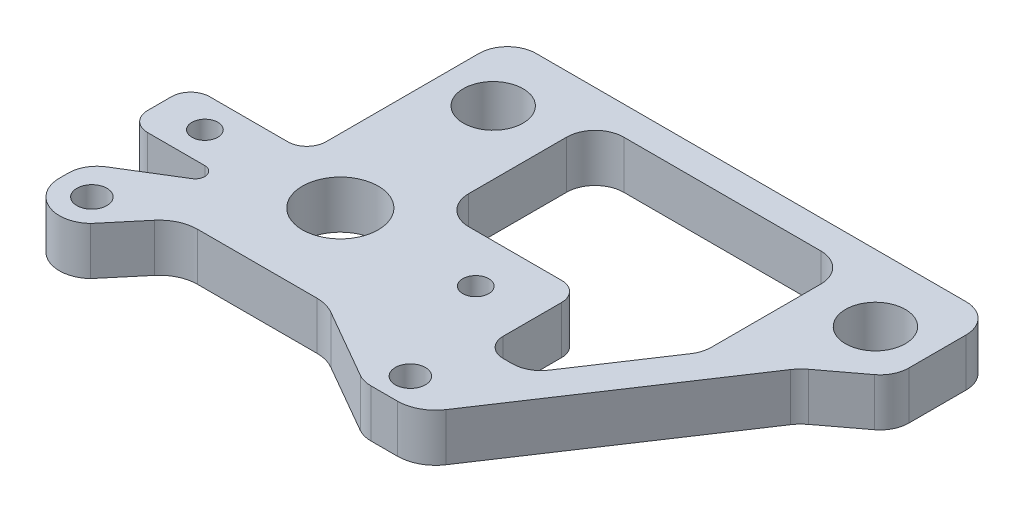
from build123d import *

# Parameters (mm, degrees)
SKETCH4_R           = 2
SKETCH4_R_2         = 1.7272
SKETCH4_R_3         = 5.04
SKETCH4_R_4         = 3.96875
BOSS_EXTRUDE2_DEPTH = 6.35
FILLET1_R           = 5.08
FILLET7_R           = 3.81
FILLET9_R           = 5.08
FILLET10_R          = 1.27
FILLET11_R          = 3.81
FILLET12_R          = 2.54
FILLET13_R          = 3.81


with BuildPart() as part:
    # Sketch4 → Boss-Extrude2 (new body)
    with BuildSketch(Plane(origin=(0, 0, 0), x_dir=(1, 0, 0), z_dir=(0, 1, 0))):
        with BuildLine():
            Line((22.483900583, -18.4375), (28.735494078, -18.4375))
            Line((28.735494078, -18.4375), (48.985566477, 12.027918285))
            Line((48.985566477, 12.027918285), (54.680415238, 16.319294633))
            ThreePointArc((54.680415238, 16.319294633), (55.797199918, 17.662082259), (56.1975, 19.362095927))
            Line((56.1975, 19.362095927), (56.1975, 26.9875))
            ThreePointArc((56.1975, 26.9875), (55.081576836, 29.681576836), (52.3875, 30.7975))
            Line((52.3875, 30.7975), (-4.7625, 30.7975))
            ThreePointArc((-4.7625, 30.7975), (-7.456576836, 29.681576836), (-8.5725, 26.9875))
            Line((-8.5725, 26.9875), (-8.5725, 12.607500122))
            Line((-8.5725, 12.607500122), (-8.5725, 4.1275))
            Line((-8.5725, 4.1275), (-24.03032317, 4.1275))
            Line((-24.03032317, 4.1275), (-24.03032317, -4.1275))
            Line((-24.03032317, -4.1275), (-9.399713355, -4.1275))
            Line((-9.399713355, -4.1275), (-22.098, -11.933490986))
            Line((-22.098, -11.933490986), (-22.098, -15.24))
            ThreePointArc((-22.098, -15.24), (-19.494143335, -19.203185162), (-14.822948297, -18.386580561))
            Line((-14.822948297, -18.386580561), (-9.399713355, -11.933490986))
            Line((-9.399713355, -11.933490986), (10.16293305, -11.933490986))
            Line((10.16293305, -11.933490986), (20.583679925, -17.929811531))
            ThreePointArc((20.583679925, -17.929811531), (21.500464498, -18.308390309), (22.483900583, -18.4375))
        make_face()
        with Locations((-17.78, -15.24)):
            Circle(SKETCH4_R, mode=Mode.SUBTRACT)
        with Locations((-18.000000004, 0)):
            Circle(SKETCH4_R_2, mode=Mode.SUBTRACT)
        Circle(SKETCH4_R_3, mode=Mode.SUBTRACT)
        with Locations((24.012521227, -14.703599027)):
            Circle(SKETCH4_R, mode=Mode.SUBTRACT)
        with Locations((18.000000004, 0)):
            Circle(SKETCH4_R_2, mode=Mode.SUBTRACT)
        with Locations((-1.5875, 21.9075)):
            Circle(SKETCH4_R_4, mode=Mode.SUBTRACT)
        Polygon((6.882386285, 6.3725), (6.882386285, 26.9875), (40.692955064, 26.9875), (40.692955064, 7.472580753), (31.404651622, -6.501297657), (25.585775375, -6.501297657), (25.585775375, 6.3725), align=None, mode=Mode.SUBTRACT)
        with Locations((49.2125, 21.9075)):
            Circle(SKETCH4_R_4, mode=Mode.SUBTRACT)
    extrude(amount=-BOSS_EXTRUDE2_DEPTH)

    # Fillet1
    fillet1_edges = [part.edges().sort_by_distance(p)[0] for p in [
        (48.985566477, -3.175, -12.027918285),
        (28.735494078, -3.175, 18.4375),
    ]]
    fillet(fillet1_edges, radius=FILLET1_R)

    # Fillet7
    fillet7_edges = [part.edges().sort_by_distance(p)[0] for p in [
        (6.882386285, -3.175, -6.3725),
        (40.692955064, -3.175, -7.472580753),
        (40.692955064, -3.175, -26.9875),
        (6.882386285, -3.175, -26.9875),
    ]]
    fillet(fillet7_edges, radius=FILLET7_R)

    # Fillet9
    fillet9_edges = [part.edges().sort_by_distance(p)[0] for p in [
        (10.16293305, -3.175, 11.933490986),
        (-9.399713355, -3.175, 11.933490986),
    ]]
    fillet(fillet9_edges, radius=FILLET9_R)

    # Fillet10
    fillet10_edges = [part.edges().sort_by_distance(p)[0] for p in [
        (-9.399713355, -3.175, 4.1275),
    ]]
    fillet(fillet10_edges, radius=FILLET10_R)

    # Fillet11
    fillet11_edges = [part.edges().sort_by_distance(p)[0] for p in [
        (-22.098, -3.175, 11.933490986),
    ]]
    fillet(fillet11_edges, radius=FILLET11_R)

    # Fillet12
    fillet12_edges = [part.edges().sort_by_distance(p)[0] for p in [
        (25.585775375, -3.175, 6.501297657),
        (25.585775375, -3.175, -6.3725),
        (-8.5725, -3.175, -4.1275),
        (-24.03032317, -3.175, -4.1275),
        (-24.03032317, -3.175, 4.1275),
    ]]
    fillet(fillet12_edges, radius=FILLET12_R)

    # Fillet13
    fillet13_edges = [part.edges().sort_by_distance(p)[0] for p in [
        (31.404651622, -3.175, 6.501297657),
    ]]
    fillet(fillet13_edges, radius=FILLET13_R)


solid = part.part
